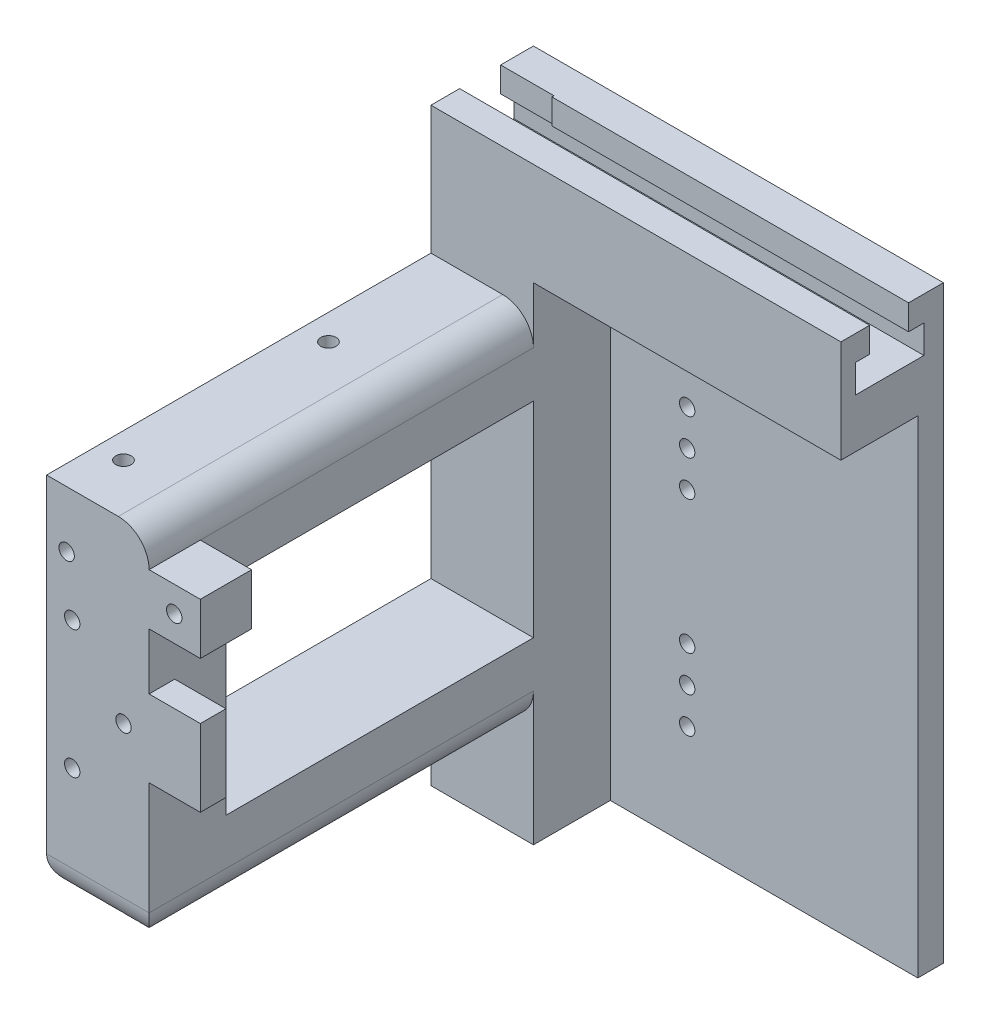
from build123d import *

# Parameters (mm, degrees)
SKETCH1_W           = 80
SKETCH1_H           = 115
BOSS_EXTRUDE1_DEPTH = 20
SKETCH2_W           = 60
SKETCH2_H           = 15
BOSS_EXTRUDE2_DEPTH = 20
SKETCH4_W           = 10
SKETCH4_H           = 10
SKETCH4_W_2         = 5
SKETCH4_H_2         = 15
BOSS_EXTRUDE3_DEPTH = 10
SKETCH3_R           = 1.5
CUT_EXTRUDE1_DEPTH  = 15
SKETCH6_R           = 1.5
CUT_EXTRUDE3_DEPTH  = 15
SKETCH7_R           = 1.5
CUT_EXTRUDE4_DEPTH  = 136.157942631
SKETCH8_W           = 60
SKETCH8_H           = 95
CUT_EXTRUDE5_DEPTH  = 15
SKETCH9_W           = 7.6
SKETCH9_H           = 4.9
CUT_EXTRUDE6_DEPTH  = 158.970880442
SKETCH10_W          = 10.4
SKETCH10_H          = 7.8
CUT_EXTRUDE7_DEPTH  = 160.257246025
FILLET1_R           = 6
FILLET2_R           = 6
FILLET3_R           = 6
FILLET4_START       = -25
FILLET4_DEPTH       = 22


with BuildPart() as part:
    # Sketch1 → Boss-Extrude1 (new body)
    with BuildSketch(Plane.XY):
        with Locations((15.793103448, -40.120689655)):
            Rectangle(SKETCH1_W, SKETCH1_H)
    extrude(amount=BOSS_EXTRUDE1_DEPTH)

    # Sketch2 → Boss-Extrude2 (add)
    with BuildSketch(Plane.ZY.offset(24.206896552)):
        with Locations((50, -15.120689655)):
            Rectangle(SKETCH2_W, SKETCH2_H)
        Polygon((80, -7.620689655), (80, -22.620689655), (80, -62.620689655), (80, -77.620689655), (95, -77.620689655), (95, -7.620689655), align=None)
        with Locations((50, -70.120689655)):
            Rectangle(SKETCH2_W, SKETCH2_H)
    extrude(amount=-BOSS_EXTRUDE2_DEPTH)

    # Sketch4 → Boss-Extrude3 (add)
    with BuildSketch(Plane(origin=(-4.206896552, 0, 0), x_dir=(0, 0, -1), z_dir=(1, 0, 0))):
        with Locations((-90, -18.620689655)):
            Rectangle(SKETCH4_W, SKETCH4_H)
        with Locations((-92.5, -42.120689655)):
            Rectangle(SKETCH4_W_2, SKETCH4_H_2)
    extrude(amount=BOSS_EXTRUDE3_DEPTH)

    # Sketch3 → Cut-Extrude1 (cut)
    with BuildSketch(Plane.XY.offset(95)):
        with Locations((0.707744923, -18.620689655)):
            Circle(SKETCH3_R)
        with Locations((-20.292255077, -18.620689655)):
            Circle(SKETCH3_R)
        with Locations((-19.206896552, -29.620689655)):
            Circle(SKETCH3_R)
        with Locations((-19.206896552, -54.620689655)):
            Circle(SKETCH3_R)
        with Locations((-9.206896552, -42.120689655)):
            Circle(SKETCH3_R)
    extrude(amount=-CUT_EXTRUDE1_DEPTH, mode=Mode.SUBTRACT)

    # Sketch6 → Cut-Extrude3 (cut)
    with BuildSketch(Plane(origin=(0, -7.620689655, 0), x_dir=(1, 0, 0), z_dir=(0, 1, 0))):
        with Locations(Location((-19.206896552, -85, 0), (0, 0, 180))):
            Circle(SKETCH6_R)
        with Locations(Location((-19.206896552, -45, 0), (0, 0, 180))):
            Circle(SKETCH6_R)
    extrude(amount=-CUT_EXTRUDE3_DEPTH, mode=Mode.SUBTRACT)

    # Sketch7 → Cut-Extrude4 (cut, through all)
    with BuildSketch(Plane.XY.offset(20)):
        with Locations((10.793103448, -77.620689655)):
            Circle(SKETCH7_R)
        with Locations((10.793103448, -37.620689655)):
            Circle(SKETCH7_R)
        with Locations((10.793103448, -70.620689655)):
            Circle(SKETCH7_R)
        with Locations((10.793103448, -30.620689655)):
            Circle(SKETCH7_R)
        with Locations((10.793103448, -63.620689655)):
            Circle(SKETCH7_R)
        with Locations((10.793103448, -23.620689655)):
            Circle(SKETCH7_R)
    extrude(amount=-CUT_EXTRUDE4_DEPTH, mode=Mode.SUBTRACT)

    # Sketch8 → Cut-Extrude5 (cut)
    with BuildSketch(Plane.XY.offset(20)):
        with Locations((25.793103448, -50.120689655)):
            Rectangle(SKETCH8_W, SKETCH8_H)
    extrude(amount=-CUT_EXTRUDE5_DEPTH, mode=Mode.SUBTRACT)

    # Sketch9 → Cut-Extrude6 (cut, through all)
    with BuildSketch(Plane(origin=(55.793103448, 0, 0), x_dir=(0, 0, -1), z_dir=(1, 0, 0))):
        Polygon((-6.8, 12.479310345), (-14.4, 12.479310345), (-17.2, 12.479310345), (-17.2, 6.979310345), (-3.8, 6.979310345), (-3.8, 12.479310345), align=None)
        with Locations((-10.6, 14.929310345)):
            Rectangle(SKETCH9_W, SKETCH9_H)
    extrude(amount=-CUT_EXTRUDE6_DEPTH, mode=Mode.SUBTRACT)

    # Sketch10 → Cut-Extrude7 (cut, through all)
    with BuildSketch(Plane.XZ.offset(97.620689655)):
        with Locations((-19.006896552, 10.3)):
            Rectangle(SKETCH10_W, SKETCH10_H)
    extrude(amount=-CUT_EXTRUDE7_DEPTH, mode=Mode.SUBTRACT)

    # Fillet1
    fillet1_edges = [part.edges().sort_by_distance(p)[0] for p in [
        (-24.206896552, -77.620689655, 57.5),
    ]]
    fillet(fillet1_edges, radius=FILLET1_R)

    # Fillet2
    fillet2_edges = [part.edges().sort_by_distance(p)[0] for p in [
        (-4.206896552, -77.620689655, 57.5),
    ]]
    fillet(fillet2_edges, radius=FILLET2_R)

    # Fillet3
    fillet3_edges = [part.edges().sort_by_distance(p)[0] for p in [
        (-4.206896552, -7.620689655, 57.5),
    ]]
    fillet(fillet3_edges, radius=FILLET3_R)

    # Fillet4: read off the stored shape, not the designer's step
    # Fillet4 outline → Fillet4 (cut)
    with BuildSketch(Plane.YZ.offset(FILLET4_START)):
        with BuildLine():
            Line((-77.620689655, 95), (-77.620689655, 89))
            add(Edge.make_bspline(
                [(-77.620689655, 89), (-77.620689655, 95), (-71.620689655, 95)],
                knots=[0, 0, 0, 1, 1, 1], degree=2, weights=[1, 0.707106781, 1]))
            Line((-71.620689655, 95), (-77.620689655, 95))
        make_face()
    extrude(amount=FILLET4_DEPTH, mode=Mode.SUBTRACT)


solid = part.part
